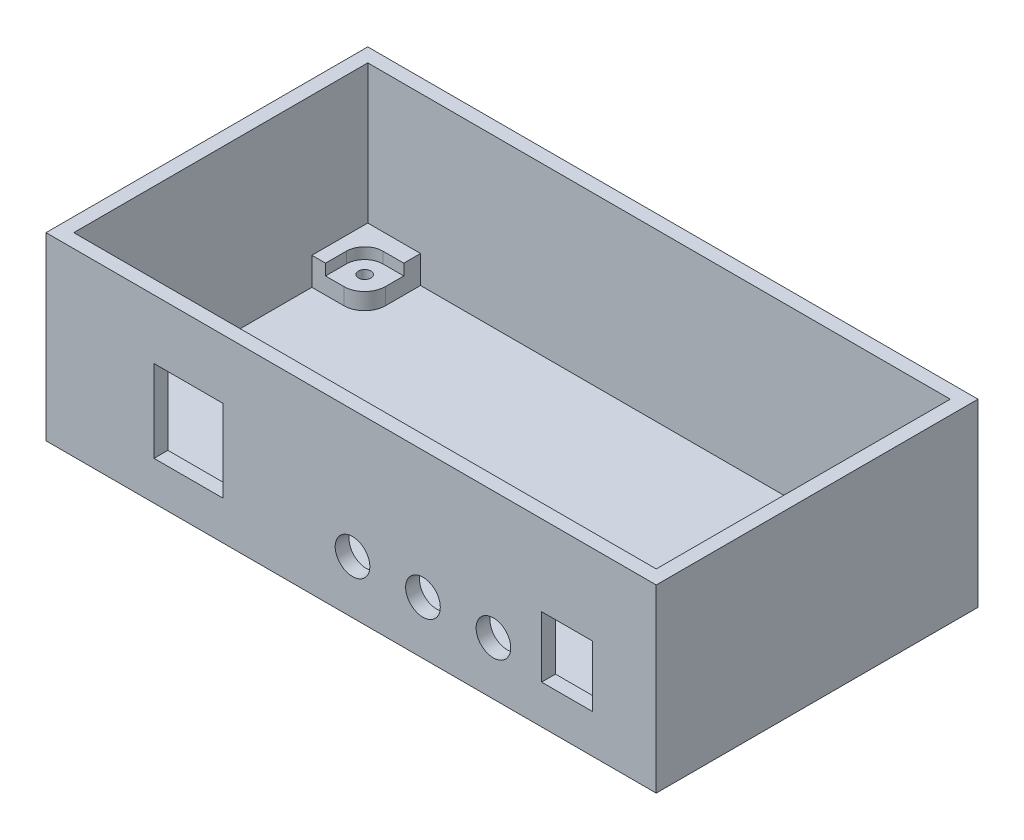
from build123d import *

# Parameters (mm, degrees)
SKETCH1_W           = 110
SKETCH1_H           = 58
BOSS_EXTRUDE1_DEPTH = 2.5
SKETCH2_W           = 110
SKETCH2_H           = 58
SKETCH2_W_2         = 105
SKETCH2_H_2         = 53
BOSS_EXTRUDE2_DEPTH = 30
CUT_EXTRUDE1_REACH  = 130.531
SKETCH3_R           = 3.125
SKETCH3_W           = 9.2
SKETCH3_H           = 11
SKETCH3_W_2         = 12.45
SKETCH3_H_2         = 14.8
SKETCH4_R           = 1.11125
CUT_EXTRUDE2_DEPTH  = 128.921851144
BOSS_EXTRUDE3_START = 5
SKETCH5_R           = 1.11125
BOSS_EXTRUDE3_DEPTH = 5
SKETCH6_R           = 1.11125
CUT_EXTRUDE3_DEPTH  = 2


with BuildPart() as part:
    # Sketch1 → Boss-Extrude1 (new body)
    with BuildSketch(Plane(origin=(0, 0, 0), x_dir=(1, 0, 0), z_dir=(0, 1, 0))):
        with Locations((55, 29)):
            Rectangle(SKETCH1_W, SKETCH1_H)
    extrude(amount=BOSS_EXTRUDE1_DEPTH)

    # Sketch2 → Boss-Extrude2 (add)
    with BuildSketch(Plane(origin=(0, 2.5, 0), x_dir=(1, 0, 0), z_dir=(0, 1, 0))):
        with Locations((55, 29)):
            Rectangle(SKETCH2_W, SKETCH2_H)
        with Locations((55, 29)):
            Rectangle(SKETCH2_W_2, SKETCH2_H_2, mode=Mode.SUBTRACT)
    extrude(amount=BOSS_EXTRUDE2_DEPTH)

    # Sketch3 → Cut-Extrude1 (cut, up to next)
    with BuildSketch(Plane.XY, mode=Mode.PRIVATE) as cut_extrude1_sk1:
        with Locations((80.65, 9.56)):
            Circle(SKETCH3_R)
    cut_extrude1_tool1 = extrude(cut_extrude1_sk1.sketch, amount=-CUT_EXTRUDE1_REACH, mode=Mode.PRIVATE) & part.part
    # Sketch3 → Cut-Extrude1 (cut, up to next)
    with BuildSketch(Plane.XY, mode=Mode.PRIVATE) as cut_extrude1_sk2:
        with Locations((67.95, 9.56)):
            Circle(SKETCH3_R)
    cut_extrude1_tool2 = extrude(cut_extrude1_sk2.sketch, amount=-CUT_EXTRUDE1_REACH, mode=Mode.PRIVATE) & part.part
    # Sketch3 → Cut-Extrude1 (cut, up to next)
    with BuildSketch(Plane.XY, mode=Mode.PRIVATE) as cut_extrude1_sk3:
        with Locations((55.25, 9.56)):
            Circle(SKETCH3_R)
    cut_extrude1_tool3 = extrude(cut_extrude1_sk3.sketch, amount=-CUT_EXTRUDE1_REACH, mode=Mode.PRIVATE) & part.part
    # Sketch3 → Cut-Extrude1 (cut, up to next)
    with BuildSketch(Plane.XY, mode=Mode.PRIVATE) as cut_extrude1_sk4:
        with Locations((93.93, 12.5)):
            Rectangle(SKETCH3_W, SKETCH3_H)
    cut_extrude1_tool4 = extrude(cut_extrude1_sk4.sketch, amount=-CUT_EXTRUDE1_REACH, mode=Mode.PRIVATE) & part.part
    # Sketch3 → Cut-Extrude1 (cut, up to next)
    with BuildSketch(Plane.XY, mode=Mode.PRIVATE) as cut_extrude1_sk5:
        with Locations((25.695, 14.4)):
            Rectangle(SKETCH3_W_2, SKETCH3_H_2)
    cut_extrude1_tool5 = extrude(cut_extrude1_sk5.sketch, amount=-CUT_EXTRUDE1_REACH, mode=Mode.PRIVATE) & part.part
    add(cut_extrude1_tool1.solids().sort_by_distance((80.65, 9.56, 0))[0], mode=Mode.SUBTRACT)
    add(cut_extrude1_tool2.solids().sort_by_distance((67.95, 9.56, 0))[0], mode=Mode.SUBTRACT)
    add(cut_extrude1_tool3.solids().sort_by_distance((55.25, 9.56, 0))[0], mode=Mode.SUBTRACT)
    add(cut_extrude1_tool4.solids().sort_by_distance((93.93, 12.5, 0))[0], mode=Mode.SUBTRACT)
    add(cut_extrude1_tool5.solids().sort_by_distance((25.695, 14.4, 0))[0], mode=Mode.SUBTRACT)

    # Sketch4 → Cut-Extrude2 (cut, through all)
    with BuildSketch(Plane(origin=(0, 2.5, 0), x_dir=(1, 0, 0), z_dir=(0, 1, 0))):
        with Locations((8.26, 6)):
            Circle(SKETCH4_R)
        with Locations((101.61, 6)):
            Circle(SKETCH4_R)
        with Locations((8.26, 49.18)):
            Circle(SKETCH4_R)
        with Locations((101.61, 49.18)):
            Circle(SKETCH4_R)
    extrude(amount=-CUT_EXTRUDE2_DEPTH, mode=Mode.SUBTRACT)

    # Sketch5 → Boss-Extrude3 (add)
    # profile 1 of 4: a face of its own
    with BuildSketch(Plane(origin=(0, 2.5, 0), x_dir=(1, 0, 0), z_dir=(0, 1, 0)).offset(BOSS_EXTRUDE3_START)):
        with BuildLine():
            Line((12.01, 49.18), (12.01, 55.5))
            Line((12.01, 55.5), (2.5, 55.5))
            Line((2.5, 55.5), (2.5, 45.43))
            Line((2.5, 45.43), (8.26, 45.43))
            ThreePointArc((8.26, 45.43), (10.911650429, 46.528349571), (12.01, 49.18))
        make_face()
        with Locations((8.26, 49.18)):
            Circle(SKETCH5_R, mode=Mode.SUBTRACT)
    # profile 2 of 4: a face of its own
    with BuildSketch(Plane(origin=(0, 2.5, 0), x_dir=(1, 0, 0), z_dir=(0, 1, 0)).offset(BOSS_EXTRUDE3_START)):
        with BuildLine():
            Line((97.86, 49.18), (97.86, 55.5))
            Line((97.86, 55.5), (107.5, 55.5))
            Line((107.5, 55.5), (107.5, 45.43))
            Line((107.5, 45.43), (101.61, 45.43))
            ThreePointArc((101.61, 45.43), (98.958349571, 46.528349571), (97.86, 49.18))
        make_face()
        with Locations((101.61, 49.18)):
            Circle(SKETCH5_R, mode=Mode.SUBTRACT)
    # profile 3 of 4: a face of its own
    with BuildSketch(Plane(origin=(0, 2.5, 0), x_dir=(1, 0, 0), z_dir=(0, 1, 0)).offset(BOSS_EXTRUDE3_START)):
        with BuildLine():
            Line((12.01, 6), (12.01, 2.5))
            Line((12.01, 2.5), (2.5, 2.5))
            Line((2.5, 2.5), (2.5, 9.75))
            Line((2.5, 9.75), (8.26, 9.75))
            ThreePointArc((8.26, 9.75), (10.911650429, 8.651650429), (12.01, 6))
        make_face()
        with Locations((8.26, 6)):
            Circle(SKETCH5_R, mode=Mode.SUBTRACT)
    # profile 4 of 4: a face of its own
    with BuildSketch(Plane(origin=(0, 2.5, 0), x_dir=(1, 0, 0), z_dir=(0, 1, 0)).offset(BOSS_EXTRUDE3_START)):
        with BuildLine():
            Line((101.61, 9.75), (107.5, 9.75))
            Line((107.5, 9.75), (107.5, 2.5))
            Line((107.5, 2.5), (97.86, 2.5))
            Line((97.86, 2.5), (97.86, 6))
            ThreePointArc((97.86, 6), (98.958349571, 8.651650429), (101.61, 9.75))
        make_face()
        with Locations((101.61, 6)):
            Circle(SKETCH5_R, mode=Mode.SUBTRACT)
    extrude(amount=-BOSS_EXTRUDE3_DEPTH)

    # Sketch6 → Cut-Extrude3 (cut)
    # profile 1 of 4: a face of its own
    with BuildSketch(Plane(origin=(0, 7.5, 0), x_dir=(1, 0, 0), z_dir=(0, 1, 0))):
        with BuildLine():
            Line((8.26, 52.48), (14.577412177, 52.48))
            Line((14.577412177, 52.48), (14.577412177, 44.4247473))
            Line((14.577412177, 44.4247473), (4.96, 44.4247473))
            Line((4.96, 44.4247473), (4.96, 49.18))
            ThreePointArc((4.96, 49.18), (5.926547622, 51.513452378), (8.26, 52.48))
        make_face()
        with Locations((8.26, 49.18)):
            Circle(SKETCH6_R, mode=Mode.SUBTRACT)
    # profile 2 of 4: a face of its own
    with BuildSketch(Plane(origin=(0, 7.5, 0), x_dir=(1, 0, 0), z_dir=(0, 1, 0))):
        with BuildLine():
            Line((101.601113891, 52.603366661), (95.283723785, 52.586667553))
            Line((95.283723785, 52.586667553), (95.305016608, 44.531442995))
            Line((95.305016608, 44.531442995), (104.922395185, 44.556865146))
            Line((104.922395185, 44.556865146), (104.909825405, 49.312101233))
            ThreePointArc((104.909825405, 49.312101233), (103.937113037, 51.642990539), (101.601113891, 52.603366661))
        make_face()
        with Locations((101.609836934, 49.30337819)):
            Circle(SKETCH6_R, mode=Mode.SUBTRACT)
    # profile 3 of 4: a face of its own
    with BuildSketch(Plane(origin=(0, 7.5, 0), x_dir=(1, 0, 0), z_dir=(0, 1, 0))):
        with BuildLine():
            Line((104.922395185, 10.623134854), (104.909825405, 5.867898767))
            ThreePointArc((104.909825405, 5.867898767), (103.937113037, 3.537009461), (101.601113891, 2.576633339))
            Line((101.601113891, 2.576633339), (95.283723785, 2.593332447))
            Line((95.283723785, 2.593332447), (95.305016608, 10.648557005))
            Line((95.305016608, 10.648557005), (104.922395185, 10.623134854))
        make_face()
    # profile 4 of 4: a face of its own
    with BuildSketch(Plane(origin=(0, 7.5, 0), x_dir=(1, 0, 0), z_dir=(0, 1, 0))):
        with BuildLine():
            Line((8.26, 2.7), (14.577412177, 2.7))
            Line((14.577412177, 2.7), (14.577412177, 10.7552527))
            Line((14.577412177, 10.7552527), (4.96, 10.7552527))
            Line((4.96, 10.7552527), (4.96, 6))
            ThreePointArc((4.96, 6), (5.926547622, 3.666547622), (8.26, 2.7))
        make_face()
    extrude(amount=-CUT_EXTRUDE3_DEPTH, mode=Mode.SUBTRACT)


solid = part.part
